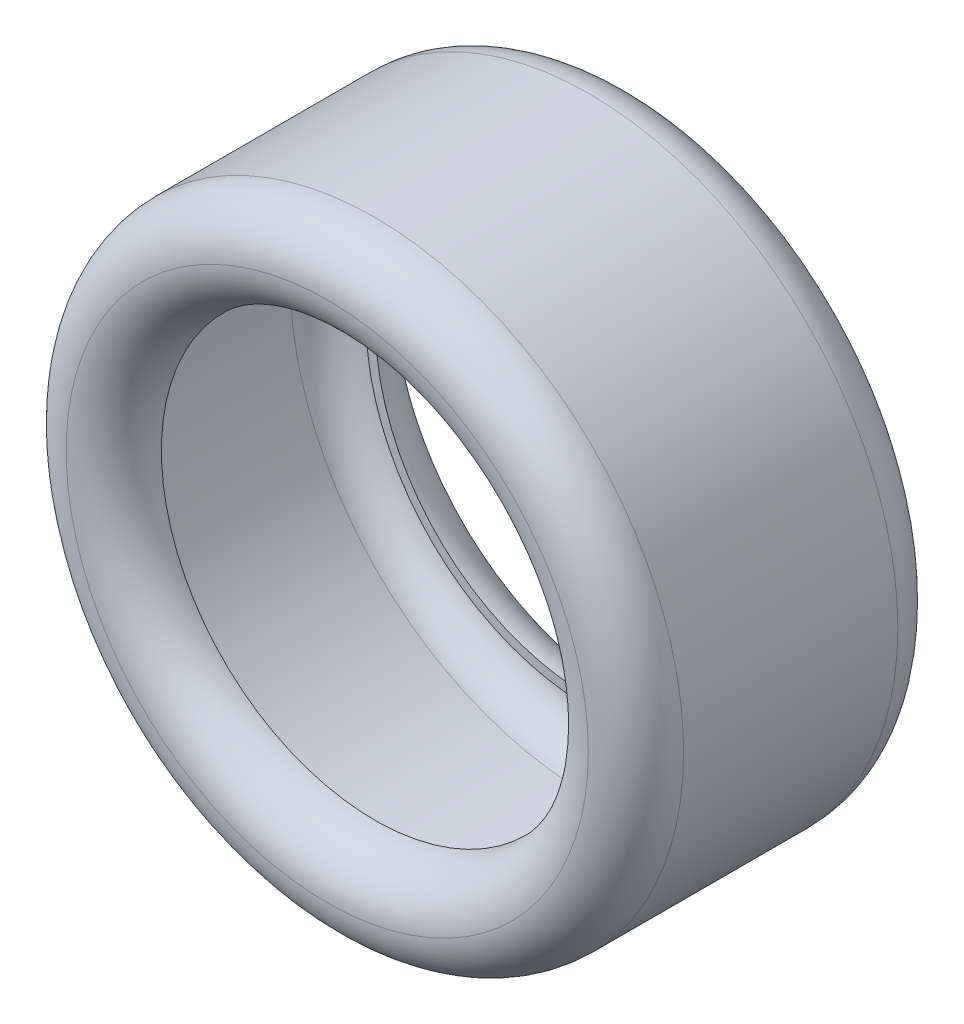
from build123d import *

# Parameters (mm, degrees)
SKETCH2_R           = 64.83
SKETCH2_R_2         = 44.83
EXTRUDE_THIN1_DEPTH = 65
FILLET1_R           = 10
FILLET2_R           = 10
FILLET3_R           = 10
FILLET4_R           = 10


# Read off the part's stored shape, not the designer's step: Shell1
with BuildPart() as part:
    # Sketch2 → Extrude-Thin1 (new body)
    with BuildSketch(Plane.XY):
        Circle(SKETCH2_R)
        Circle(SKETCH2_R_2, mode=Mode.SUBTRACT)
    extrude(amount=EXTRUDE_THIN1_DEPTH)

    # Fillet1
    fillet1_edges = [part.edges().sort_by_distance(p)[0] for p in [
        (-64.83, 0, 65),
    ]]
    fillet(fillet1_edges, radius=FILLET1_R)

    # Fillet2
    fillet2_edges = [part.edges().sort_by_distance(p)[0] for p in [
        (-64.83, 0, 0),
    ]]
    fillet(fillet2_edges, radius=FILLET2_R)

    # Fillet3
    fillet3_edges = [part.edges().sort_by_distance(p)[0] for p in [
        (-44.83, 0, 0),
    ]]
    fillet(fillet3_edges, radius=FILLET3_R - 0.0001)  # a hair under: the kernel refuses the full size

    # Fillet4
    fillet4_edges = [part.edges().sort_by_distance(p)[0] for p in [
        (-44.83, 0, 65),
    ]]
    fillet(fillet4_edges, radius=FILLET4_R - 0.0001)  # a hair under: the kernel refuses the full size

    # Shell1 outline → Shell1 (revolve, cut)
    with BuildSketch(Plane.XZ):
        with BuildLine():
            Line((44.83, 55), (44.83, 10))
            Line((44.83, 10), (46.83, 10))
            ThreePointArc((46.83, 10), (49.173145751, 4.343145751), (54.83, 2))
            ThreePointArc((54.83, 2), (60.486854249, 4.343145751), (62.83, 10))
            Line((62.83, 10), (62.83, 55))
            ThreePointArc((62.83, 55), (60.486854249, 60.656854249), (54.83, 63))
            ThreePointArc((54.83, 63), (49.173145751, 60.656854249), (46.83, 55))
            Line((46.83, 55), (44.83, 55))
        make_face()
    revolve(axis=Axis((0, 0, 0), (0, 0, 1)), mode=Mode.SUBTRACT)


solid = part.part
